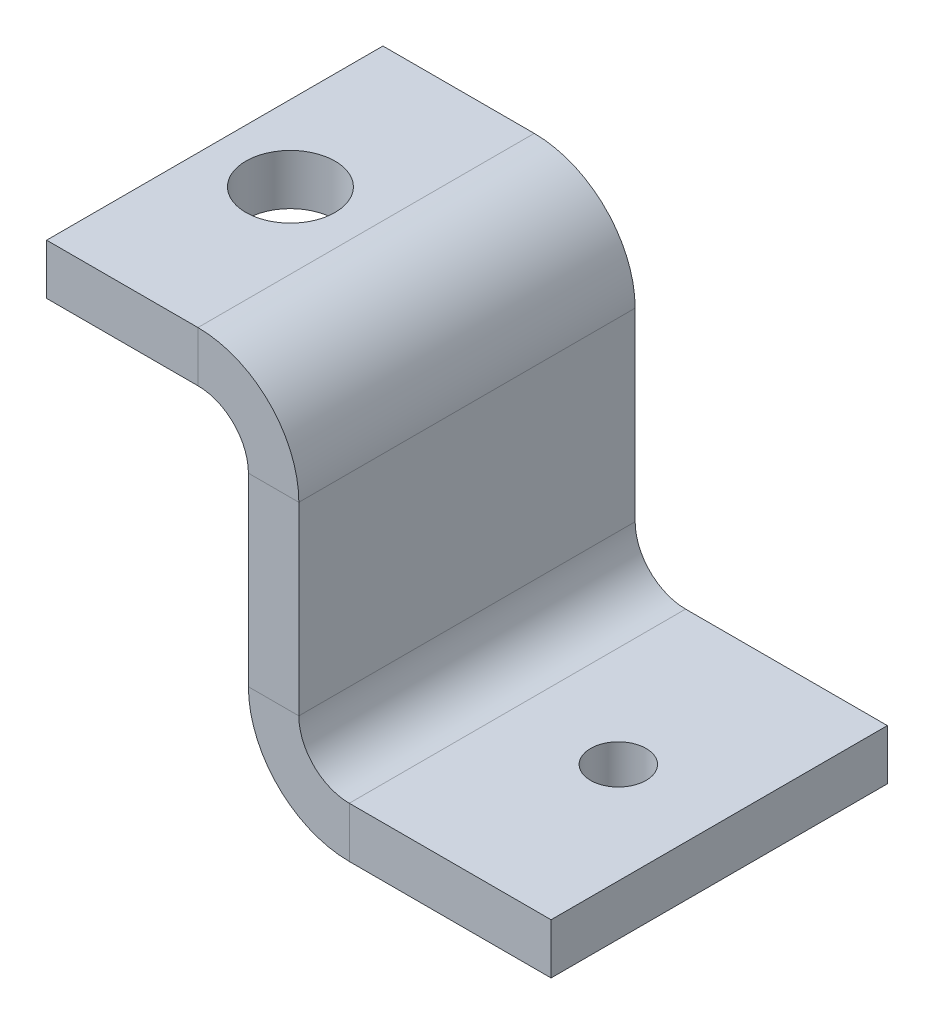
from build123d import *

# Parameters (mm, degrees)
BASE_FLANGE1_DEPTH = 20
SKETCH6_R          = 2.65
CUT_EXTRUDE1_DEPTH = 10
SKETCH7_R          = 1.65
CUT_EXTRUDE2_DEPTH = 10


# Sheet-metal steps are written as plain solids
with BuildPart() as part:
    # Sketch1 → Base-Flange1 (new body)
    with BuildSketch(Plane.XY):
        with BuildLine():
            Line((-15.568720379, 20), (-6.568720379, 20))
            ThreePointArc((-6.568720379, 20), (-2.326079692, 18.242640687), (-0.568720379, 14))
            Line((-0.568720379, 14), (-0.568720379, 3))
            ThreePointArc((-0.568720379, 3), (0.309959277, 0.878679656), (2.431279621, 0))
            Line((2.431279621, 0), (14.431279621, 0))
            Line((14.431279621, 0), (14.431279621, -3))
            Line((14.431279621, -3), (2.431279621, -3))
            ThreePointArc((2.431279621, -3), (-1.811361066, -1.242640687), (-3.568720379, 3))
            Line((-3.568720379, 3), (-3.568720379, 14))
            ThreePointArc((-3.568720379, 14), (-4.447400036, 16.121320344), (-6.568720379, 17))
            Line((-6.568720379, 17), (-15.568720379, 17))
            Line((-15.568720379, 17), (-15.568720379, 20))
        make_face()
    extrude(amount=BASE_FLANGE1_DEPTH)

    # Sketch6 → Cut-Extrude1 (cut)
    with BuildSketch(Plane(origin=(0, 20, 0), x_dir=(1, 0, 0), z_dir=(0, 1, 0))):
        with Locations(Location((-11.068720379, -10, 0), (0, 0, 270))):
            Circle(SKETCH6_R)
    extrude(amount=-CUT_EXTRUDE1_DEPTH, mode=Mode.SUBTRACT)

    # Sketch7 → Cut-Extrude2 (cut)
    with BuildSketch(Plane(origin=(0, 0, 0), x_dir=(1, 0, 0), z_dir=(0, 1, 0))):
        with Locations(Location((8.431279621, -10, 0), (0, 0, 270))):
            Circle(SKETCH7_R)
    extrude(amount=-CUT_EXTRUDE2_DEPTH, mode=Mode.SUBTRACT)


solid = part.part
